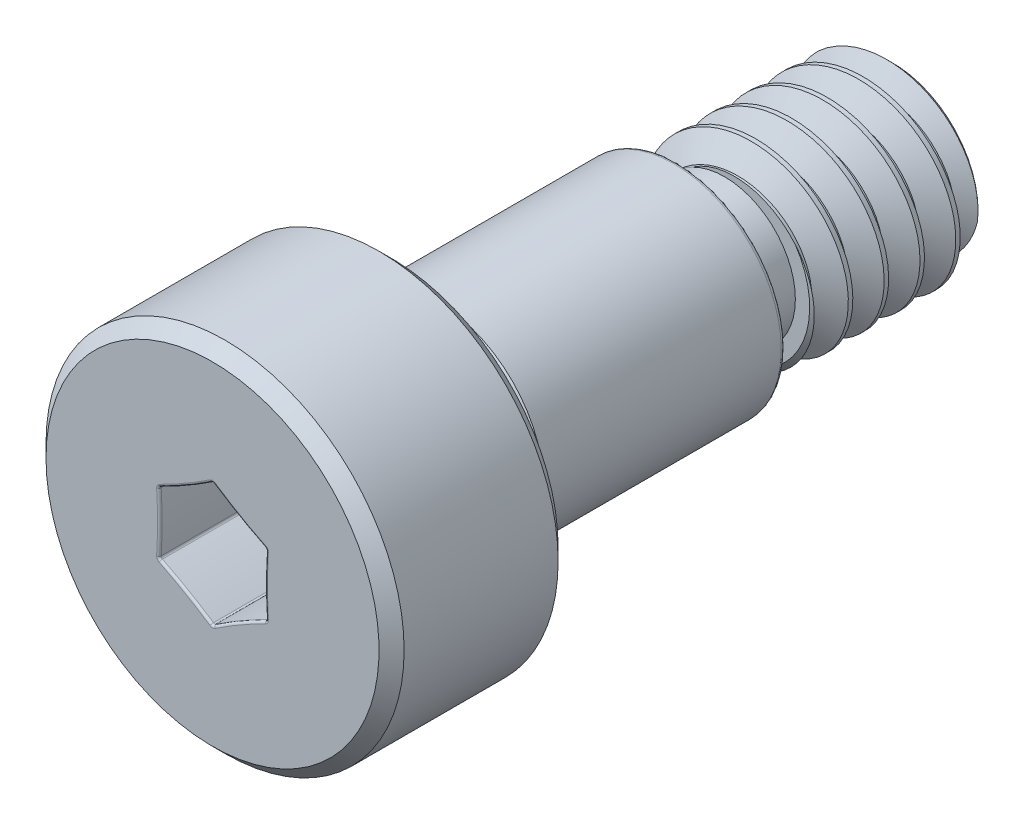
from build123d import *

# Parameters (mm, degrees)
SKETCH4_W              = 1.031875000000002
SKETCH4_H              = 0.5155557481904252
CHAMFER1_SIZE          = 0.3571875
FILLET1_R              = 0.17859375
FILLET2_R              = 0.15875
CHAMFER2_SIZE          = 0.1984375
FILLET3_R              = 0.09525
CHAMFER3_SIZE          = 0.2778125
CUT_EXTRUDE1_DEPTH     = 2.0828
FILLET4_R              = 0.0508
DELETEFACE1_START      = -7.381875
DELETEFACE1_OUTLINE_W  = 6
DELETEFACE1_OUTLINE_H  = 6
DELETEFACE1_OUTLINE_R  = 1.567244252
DELETEFACE1_DEPTH      = 0.1587501
CUT_SWEEP1_PITCH       = 0.7937499999999992
CUT_SWEEP1_HEIGHT      = 4.3497499999999985
CUT_SWEEP1_RADIUS      = 2.0828
CUT_SWEEP1_START_ANGLE = 89.99999999999977


# Read off the part's stored shape, not the designer's step: DeleteFace1
with BuildPart() as part:
    # Sketch3 → Revolve1 (revolve)
    with BuildSketch(Plane(origin=(0, 0, 0), x_dir=(0, 0, -1), z_dir=(1, 0, 0)), mode=Mode.PRIVATE) as revolve1_sk:
        Polygon((-3.96875, 3.9687499999999982), (0, 3.96875), (0, 2.38125), (6.35, 2.381250000000001), (6.35, 2.0828000000000015), (11.112499999999999, 2.0828000000000015), (11.112499999999999, -7.8e-16), (-3.96875, 0), align=None)
    revolve(revolve1_sk.sketch.rotate(Axis((0, 0, 3.96875), (0, 0, -1)), 90), axis=Axis((0, 0, 3.96875), (0, 0, -1)))

    # Sketch4 → Cut-Revolve1 (revolve, cut)
    with BuildSketch(Plane(origin=(0, 0, 0), x_dir=(0, 0, -1), z_dir=(1, 0, 0)), mode=Mode.PRIVATE) as cut_revolve1_sk:
        Polygon((0, 2.38125), (0.9921875, 2.38125), (0.9921875, 2.0240625), (-5e-17, 2.0240625), align=None)
        with Locations((6.865937499999999, 1.825022125904789)):
            Rectangle(SKETCH4_W, SKETCH4_H)
    revolve(cut_revolve1_sk.sketch.rotate(Axis((0, 0, 3.96875), (0, 0, -1)), 90), axis=Axis((0, 0, 3.96875), (0, 0, -1)), mode=Mode.SUBTRACT)

    # Chamfer1
    chamfer1_edges = [part.edges().sort_by_distance(p)[0] for p in [
        (-2.0240625, -4.7e-16, -0.9921875),
    ]]
    chamfer(chamfer1_edges, length=CHAMFER1_SIZE - 0.0001)  # a hair under: the kernel refuses the full size

    # Fillet1
    fillet1_edges = [part.edges().sort_by_distance(p)[0] for p in [
        (-2.0240625, -4.7e-16, 0),
    ]]
    fillet(fillet1_edges, radius=FILLET1_R)

    # Fillet2
    fillet2_edges = [part.edges().sort_by_distance(p)[0] for p in [
        (-1.5672442518095764, -3.7e-16, -6.35),
        (-1.5672442518095764, -3.7e-16, -7.381875000000001),
    ]]
    fillet(fillet2_edges, radius=FILLET2_R)

    # Chamfer2
    chamfer2_edges = [part.edges().sort_by_distance(p)[0] for p in [
        (-2.0828000000000015, -4.9e-16, -7.381875000000001),
        (-2.0828000000000015, -4.9e-16, -11.112499999999999),
    ]]
    chamfer(chamfer2_edges, length=CHAMFER2_SIZE)

    # Fillet3
    fillet3_edges = [part.edges().sort_by_distance(p)[0] for p in [
        (-2.381250000000001, -5.6e-16, -6.35),
    ]]
    fillet(fillet3_edges, radius=FILLET3_R)

    # Chamfer3
    chamfer3_edges = [part.edges().sort_by_distance(p)[0] for p in [
        (-3.96875, -9.3e-16, 0),
        (-3.9687499999999982, -9.3e-16, 3.96875),
    ]]
    chamfer(chamfer3_edges, length=CHAMFER3_SIZE)

    # Sketch5 → Cut-Extrude1 (cut)
    with BuildSketch(Plane.XY.offset(3.96875)):
        with BuildLine():
            ThreePointArc((1.1906250000000003, 0.6874076642538982), (0.5834062499999995, 1.0104892664532308), (4.2e-16, 1.3748153285077966))
            ThreePointArc((4.2e-16, 1.3748153285077966), (-0.5834062500000003, 1.0104892664532308), (-1.1906249999999998, 0.687407664253899))
            ThreePointArc((-1.1906249999999998, 0.687407664253899), (-1.166812499999999, 4.7e-16), (-1.190625, -0.6874076642538981))
            ThreePointArc((-1.190625, -0.6874076642538981), (-0.5834062499999995, -1.010489266453229), (7e-17, -1.3748153285077966))
            ThreePointArc((7e-17, -1.3748153285077966), (0.5834062499999995, -1.010489266453229), (1.1906250000000003, -0.6874076642538983))
            ThreePointArc((1.1906250000000003, -0.6874076642538983), (1.166812499999999, -1.75e-15), (1.1906250000000003, 0.6874076642538982))
        make_face()
    extrude(amount=-CUT_EXTRUDE1_DEPTH, mode=Mode.SUBTRACT)

    # Fillet4
    fillet4_edges = [part.edges().sort_by_distance(p)[0] for p in [
        (1.1668125000000007, -6e-17, 1.8859499999999998),
        (1.1906250000000007, 0.6874076642538973, 2.9273499999999997),
        (0.5834062499999986, -1.0104892664532272, 1.8859499999999998),
        (1.1906250000000003, -0.6874076642538983, 2.9273499999999997),
        (-0.5834062499999995, -1.0104892664532308, 1.8859499999999998),
        (-8.9e-16, -1.3748153285077969, 2.9273499999999997),
        (-1.166812499999999, 5e-16, 1.8859499999999998),
        (-1.1906249999999994, -0.6874076642538982, 2.9273499999999997),
        (-0.5834062499999995, 1.0104892664532326, 1.8859499999999998),
        (-1.1906249999999994, 0.6874076642538987, 2.9273499999999997),
        (0.5834062499999995, 1.010489266453229, 1.8859499999999998),
        (0, 1.3748153285077969, 2.9273499999999997),
        (1.1668125000000007, -6e-17, 3.96875),
        (0.5834062499999995, 1.010489266453229, 3.96875),
        (-0.5834062499999995, 1.0104892664532326, 3.96875),
        (-1.166812499999999, 5e-16, 3.96875),
        (-0.5834062499999995, -1.0104892664532308, 3.96875),
        (0.5834062499999986, -1.0104892664532272, 3.96875),
    ]]
    fillet(fillet4_edges, radius=FILLET4_R)

    # DeleteFace1 outline → DeleteFace1 (cut)
    with BuildSketch(Plane.XY.offset(DELETEFACE1_START)):
        Rectangle(DELETEFACE1_OUTLINE_W, DELETEFACE1_OUTLINE_H)
        Circle(DELETEFACE1_OUTLINE_R, mode=Mode.SUBTRACT)
    extrude(amount=DELETEFACE1_DEPTH, mode=Mode.SUBTRACT)

    # Cut-Sweep1: sweep along a helix
    with BuildLine() as cut_sweep1_path:
        add(Helix(CUT_SWEEP1_PITCH, CUT_SWEEP1_HEIGHT, CUT_SWEEP1_RADIUS, center=(0, 0, -11.112499999999999), direction=(0, 0, 1), mode=Mode.PRIVATE).rotate(Axis((0, 0, -11.112499999999999), (0, 0, 1)), CUT_SWEEP1_START_ANGLE))
    # Sketch7 → Cut-Sweep1 (sweep, cut)
    with BuildSketch(Plane(origin=(0, 0, 0), x_dir=(0, 0, -1), z_dir=(1, 0, 0))):
        Polygon((11.087695312499996, 2.1257629790158723), (11.8318359375, 2.1257629790158723), (11.509374999999997, 1.5672442518095764), (11.41015625, 1.5672442518095764), align=None)
    sweep(path=cut_sweep1_path.line, is_frenet=True, mode=Mode.SUBTRACT)


solid = part.part
